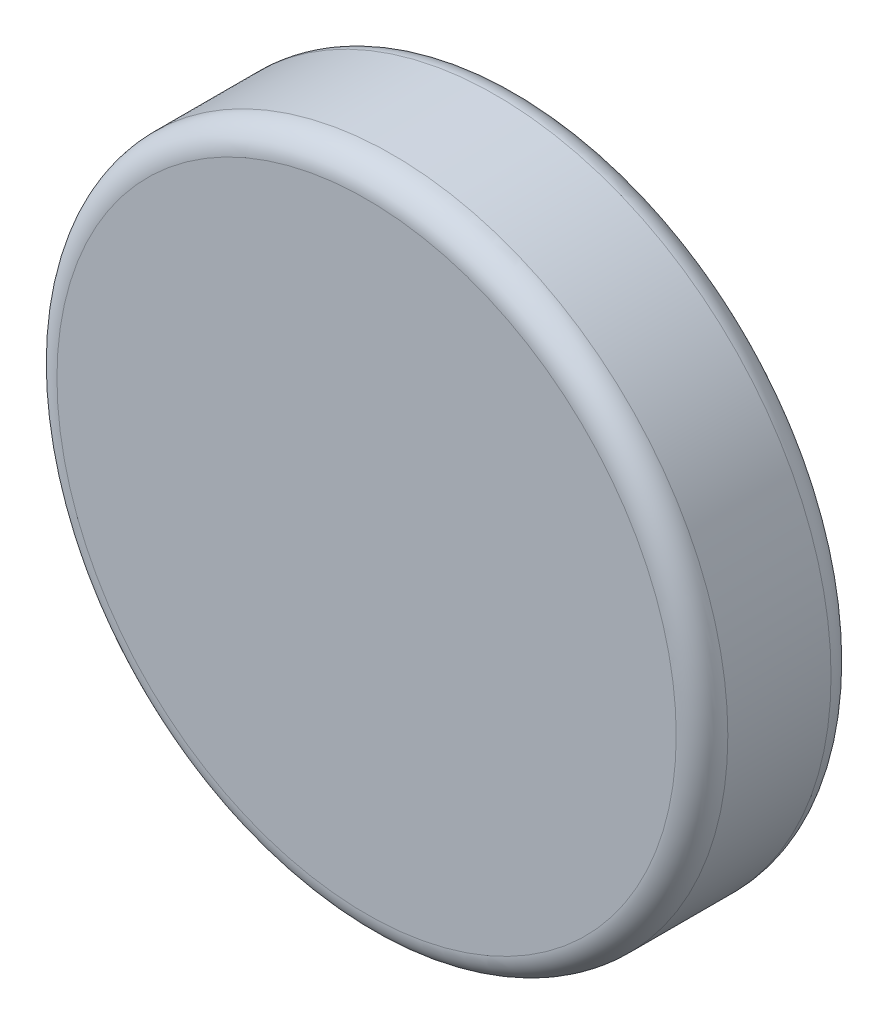
from build123d import *

# Parameters (mm, degrees)
SKETCH_1_R          = 13
EXTRUDE_1_DEPTH     = 6
SKETCH_2_R          = 0.725
CUT_EXTRUDE_1_DEPTH = 4
SKETCH_3_R          = 11
SKETCH_3_R_2        = 2.5
CUT_EXTRUDE_2_DEPTH = 4
FILLET_1_R          = 1
FILLET_2_R          = 1
FILLET_3_R          = 0.2
FILLET_4_R          = 0.2


with BuildPart() as part:
    # Эскиз1 → Бобышка-Вытянуть1 (new body)
    with BuildSketch(Plane.XY):
        Circle(SKETCH_1_R)
    extrude(amount=EXTRUDE_1_DEPTH)

    # Эскиз2 → Вырез-Вытянуть1 (cut)
    with BuildSketch(Plane(origin=(0, 0, 0), x_dir=(-1, 0, 0), z_dir=(0, 0, -1))):
        Circle(SKETCH_2_R)
    extrude(amount=-CUT_EXTRUDE_1_DEPTH, mode=Mode.SUBTRACT)

    # Эскиз3 → Вырез-Вытянуть2 (cut)
    with BuildSketch(Plane(origin=(0, 0, 0), x_dir=(-1, 0, 0), z_dir=(0, 0, -1))):
        Circle(SKETCH_3_R)
        Circle(SKETCH_3_R_2, mode=Mode.SUBTRACT)
    extrude(amount=-CUT_EXTRUDE_2_DEPTH, mode=Mode.SUBTRACT)

    # Скругление1
    fillet_1_edges = [part.edges().sort_by_distance(p)[0] for p in [
        (11, 0, 0),
        (-13, 0, 0),
    ]]
    fillet(fillet_1_edges, radius=FILLET_1_R - 0.0001)  # a hair under: the kernel refuses the full size

    # Скругление2
    fillet_2_edges = [part.edges().sort_by_distance(p)[0] for p in [
        (-13, 0, 6),
    ]]
    fillet(fillet_2_edges, radius=FILLET_2_R)

    # Скругление3
    fillet_3_edges = [part.edges().sort_by_distance(p)[0] for p in [
        (2.5, 0, 0),
        (0.725, 0, 0),
    ]]
    fillet(fillet_3_edges, radius=FILLET_3_R)

    # Скругление4
    fillet_4_edges = [part.edges().sort_by_distance(p)[0] for p in [
        (11, 0, 4),
        (2.5, 0, 4),
    ]]
    fillet(fillet_4_edges, radius=FILLET_4_R)


solid = part.part
